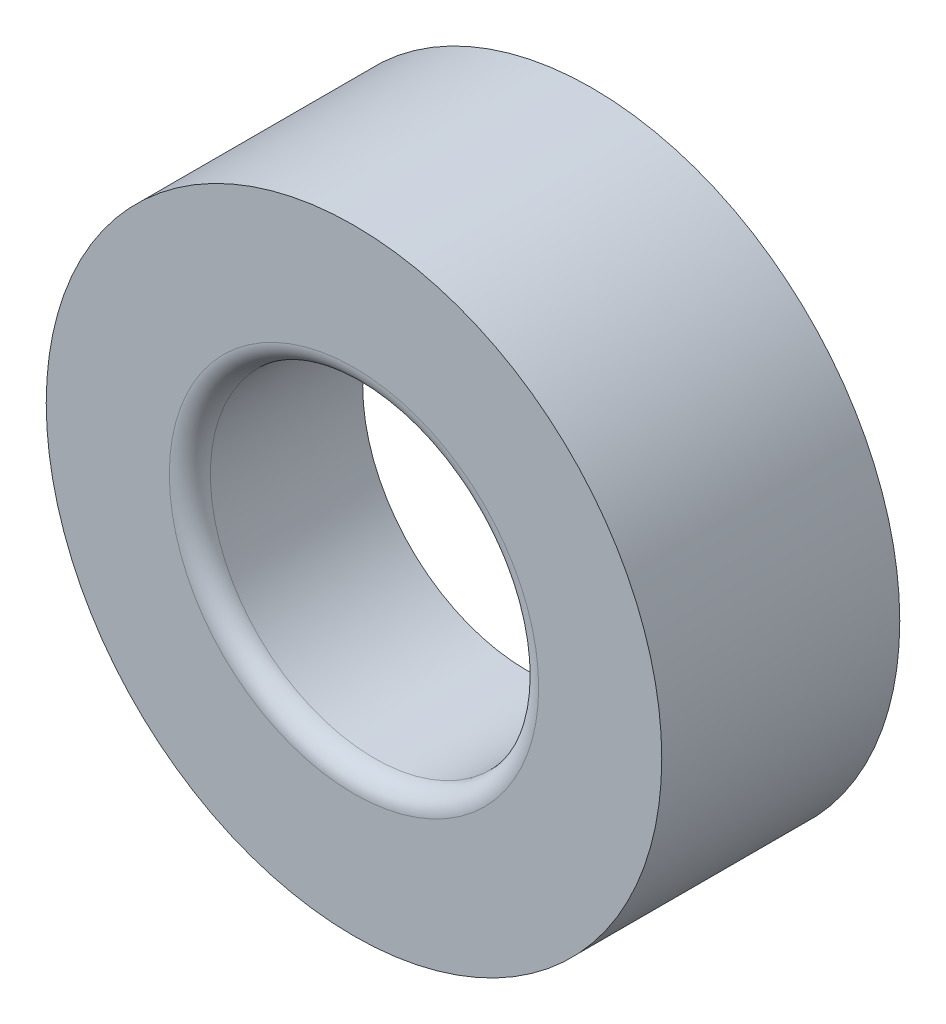
from build123d import *

# Parameters (mm, degrees)
SKETCH1_R           = 7.5
BOSS_EXTRUDE1_DEPTH = 5.8
SKETCH2_R           = 4
CUT_EXTRUDE1_DEPTH  = 94.348604063
SKETCH3_R           = 6.4
CUT_EXTRUDE2_DEPTH  = 1.5875
FILLET1_R           = 0.5


with BuildPart() as part:
    # Sketch1 → Boss-Extrude1 (new body)
    with BuildSketch(Plane.XY):
        with Locations((85.206527413, -1.763997815)):
            Circle(SKETCH1_R)
    extrude(amount=BOSS_EXTRUDE1_DEPTH)

    # Sketch2 → Cut-Extrude1 (cut, through all)
    with BuildSketch(Plane.XY.offset(5.8)):
        with Locations((85.206527413, -1.763997815)):
            Circle(SKETCH2_R)
    extrude(amount=-CUT_EXTRUDE1_DEPTH, mode=Mode.SUBTRACT)

    # Sketch3 → Cut-Extrude2 (cut)
    with BuildSketch(Plane(origin=(0, 0, 0), x_dir=(-1, 0, 0), z_dir=(0, 0, -1))):
        with Locations((-85.206527413, -1.763997815)):
            Circle(SKETCH3_R)
    extrude(amount=-CUT_EXTRUDE2_DEPTH, mode=Mode.SUBTRACT)

    # Fillet1
    fillet1_edges = [part.edges().sort_by_distance(p)[0] for p in [
        (81.206527413, -1.763997815, 5.8),
    ]]
    fillet(fillet1_edges, radius=FILLET1_R)


solid = part.part
